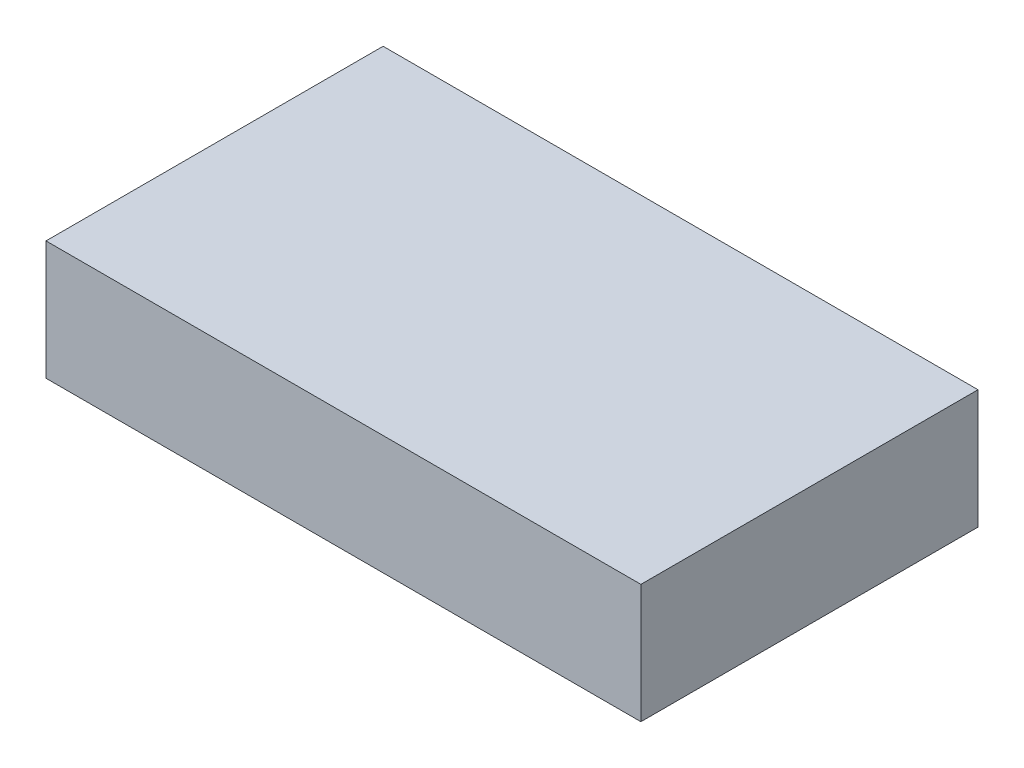
from build123d import *

# Parameters (mm, degrees)
SKETCH1_W           = 30
SKETCH1_H           = 17
BOSS_EXTRUDE1_DEPTH = 6


with BuildPart() as part:
    # Sketch1 → Boss-Extrude1 (new body)
    with BuildSketch(Plane(origin=(0, 0, 0), x_dir=(1, 0, 0), z_dir=(0, 1, 0))):
        with Locations((15, 8.5)):
            Rectangle(SKETCH1_W, SKETCH1_H)
    extrude(amount=BOSS_EXTRUDE1_DEPTH)


solid = part.part
